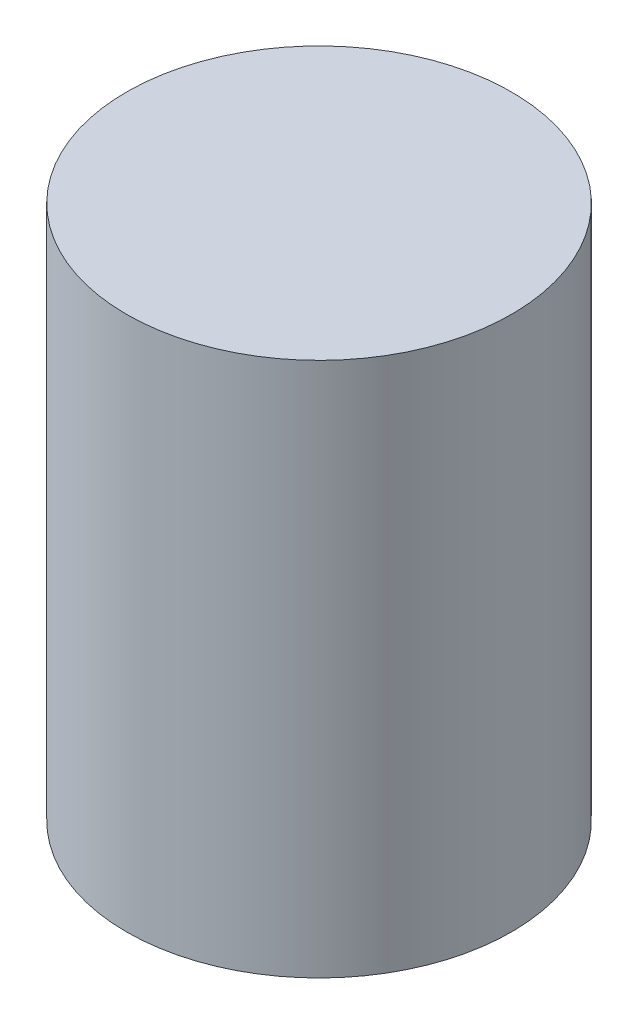
from build123d import *

# Parameters (mm, degrees)
SKETCH1_R           = 18
BOSS_EXTRUDE1_DEPTH = 50


with BuildPart() as part:
    # Sketch1 → Boss-Extrude1 (new body)
    with BuildSketch(Plane(origin=(0, 0, 0), x_dir=(1, 0, 0), z_dir=(0, 1, 0))):
        Circle(SKETCH1_R)
    extrude(amount=BOSS_EXTRUDE1_DEPTH)


solid = part.part
